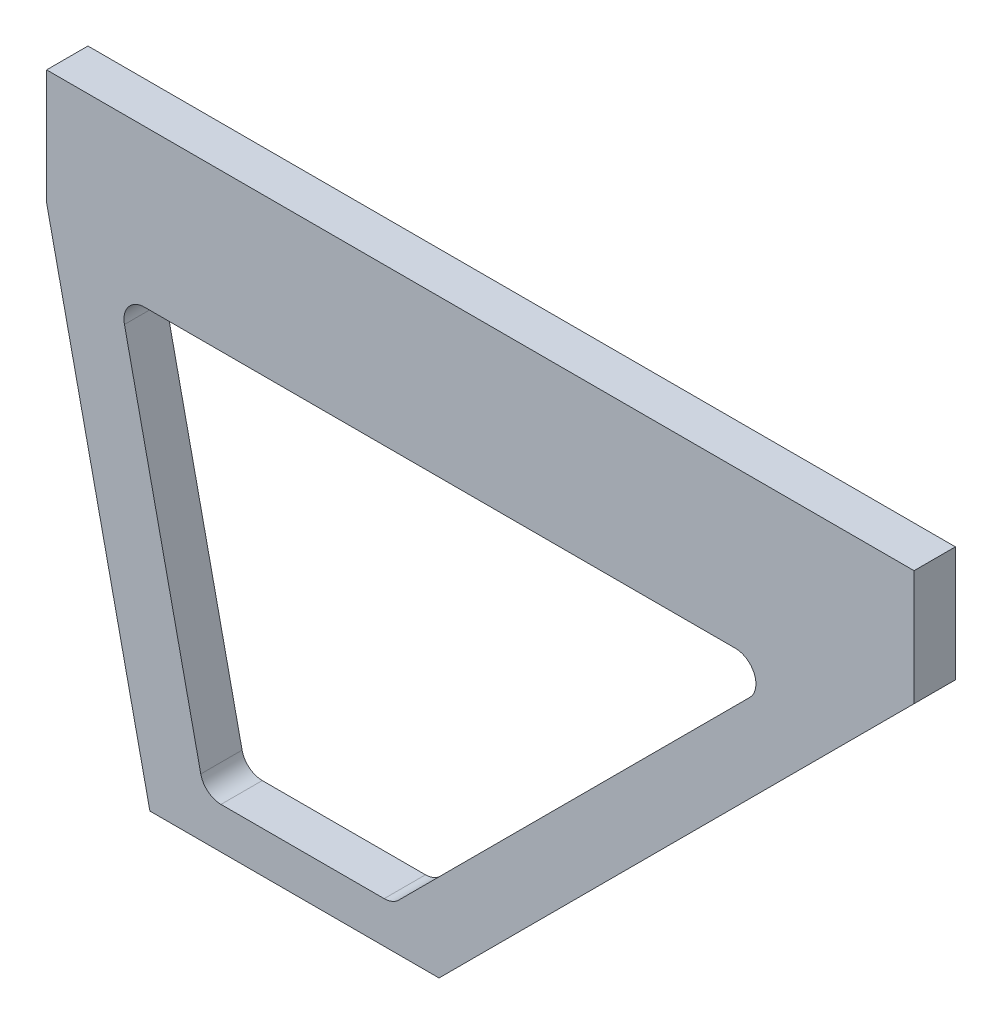
from build123d import *

# Parameters (mm, degrees)
BOSS_EXTRU_1_DEPTH = 5
FILLET1_R          = 5


with BuildPart() as part:
    # Esquisse2 → Boss.-Extru.1 (new, symmetric)
    with BuildSketch(Plane.XY):
        Polygon((-30.197209457, -50.23903484), (-5.197209457, -165.23903484), (64.802790543, -165.23903484), (179.802790543, -50.23903484), (179.802790543, -22.33903484), (-30.197209457, -22.33903484), align=None)
        Polygon((53.589587107, -155.23903484), (148.589587107, -60.23903484), (-12.672945593, -60.23903484), (7.97922832, -155.23903484), align=None, mode=Mode.SUBTRACT)
    extrude(amount=BOSS_EXTRU_1_DEPTH, both=True)

    # Fillet1
    fillet1_edges = [part.edges().sort_by_distance(p)[0] for p in [
        (148.589587107, -60.23903484, 0),
        (-12.672945593, -60.23903484, 0),
        (7.97922832, -155.23903484, 0),
        (53.589587107, -155.23903484, 0),
    ]]
    fillet(fillet1_edges, radius=FILLET1_R)


solid = part.part
